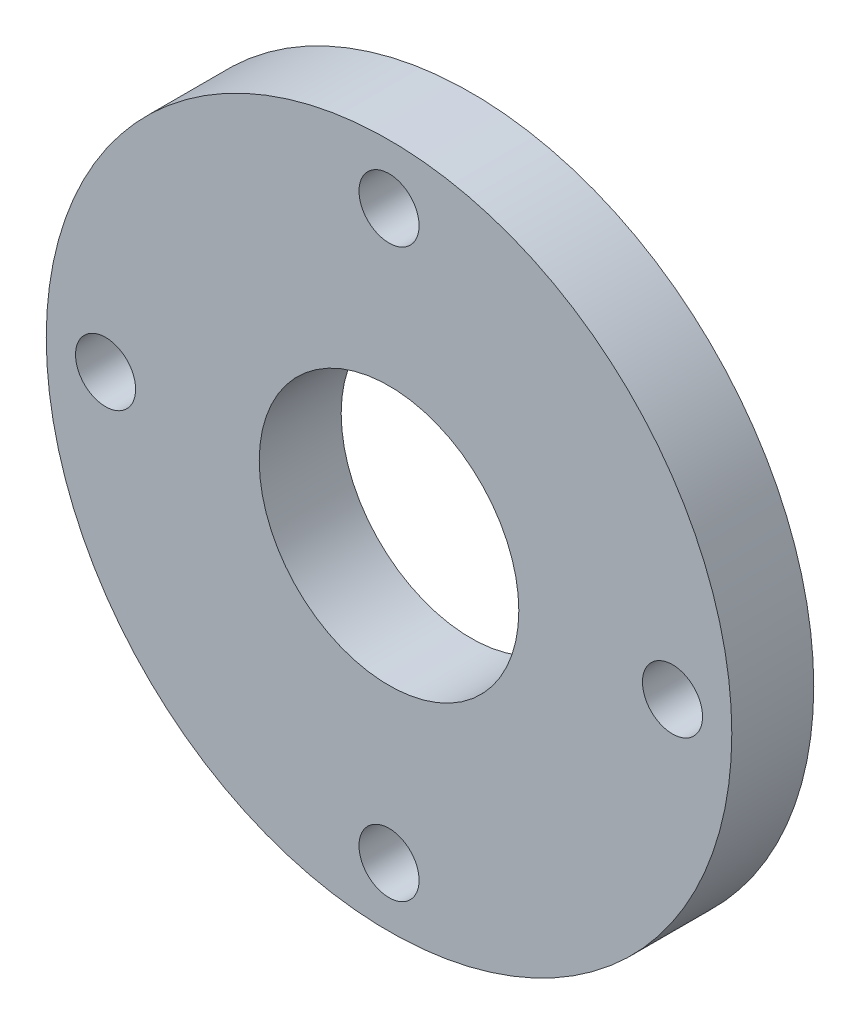
from build123d import *

# Parameters (mm, degrees)
SKETCH1_W            = 9.000000034
SKETCH1_H            = 28.14914995
SKETCH5_R            = 14.25575
SEAL_SEAT_DEPTH      = 54.999231402
M6_CLEARANCE_HOLE1_D = 6.6
CIRPATTERN1_COUNT    = 4


with BuildPart() as part:
    # Sketch1 → Main_body (revolve)
    with BuildSketch(Plane(origin=(0, 0, 0), x_dir=(0, 0, -1), z_dir=(1, 0, 0))):
        with Locations((-123.969000093, 23.574575025)):
            Rectangle(SKETCH1_W, SKETCH1_H)
    revolve(axis=Axis((0, 0, 1000), (0, 0, -1)))

    # Sketch5 → seal_seat (cut, through all)
    with BuildSketch(Plane.XY.offset(128.46900011)):
        Circle(SKETCH5_R)
    extrude(amount=-SEAL_SEAT_DEPTH, mode=Mode.SUBTRACT)

    # M6 Clearance Hole1 (through all)
    with Locations(Plane.XY.offset(128.46900011)):
        with Locations((0, 31.133925032)):
            m6_clearance_hole1 = Hole(M6_CLEARANCE_HOLE1_D / 2)

    # CirPattern1: M6 Clearance Hole1 ×4 about axis
    cirpattern1_axis = Axis((0, 0, 1000), (0, 0, -1))
    for i in range(1, CIRPATTERN1_COUNT):
        add(m6_clearance_hole1.rotate(cirpattern1_axis, i * 360 / CIRPATTERN1_COUNT), mode=Mode.SUBTRACT)


solid = part.part
